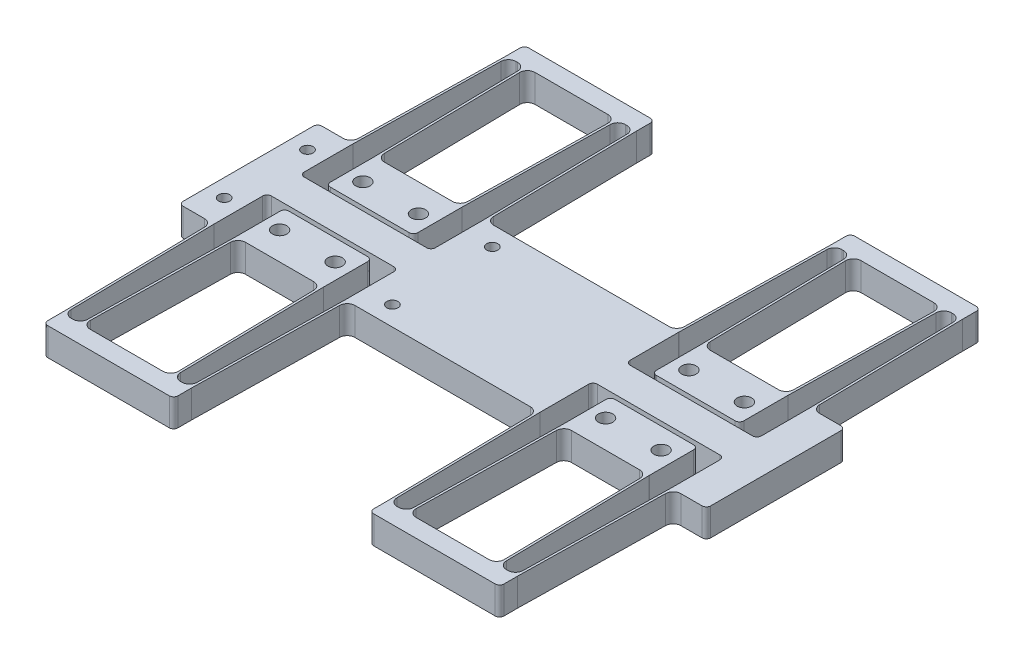
from build123d import *

# Parameters (mm, degrees)
ADJUST_THIS_FLEXTURE_CORNER_W              = 40
ADJUST_THIS_FLEXTURE_CORNER_H              = 22.25
CORNER_EXTRUDE_DEPTH                       = 6.35
FLEXTURE_BEAM_FILLETS_R                    = 3.5
OUTER_FILLETS_R                            = 2
M6_CLEARANCE_HOLE1_D                       = 6.6
FLEXTURE_BEAM_FILLETS_OF_LEFT_RIGHT_MIRR_R = 3.5
OUTER_FILLETS_OF_LEFT_RIGHT_MIRROR_R       = 2
TOP_BOTTOM_MIRROR_START                    = -6.35
TOP_BOTTOM_MIRROR_OUTLINE_R                = 3.3
TOP_BOTTOM_MIRROR_DEPTH                    = 12.7
F_1_4_20_TAPPED_HOLE1_D                    = 5.1054


# Read off the part's stored shape, not the designer's step: Top-Bottom-Mirror
with BuildPart() as part:
    # ADJUST THIS Flexture-Corner → Corner-Extrude (new, symmetric)
    with BuildSketch(Plane(origin=(0, 0, 0), x_dir=(1, 0, 0), z_dir=(0, 1, 0))):
        Polygon((-120.65, 0), (0, 0), (0, 31.75), (-44.549, 31.75), (-44.549, 7.5), (-104.549, 7.5), (-104.549, 31.75), (-120.65, 31.75), align=None)
        Polygon((-44.770702217, 101.75), (-44.770702217, 110), (-104.327297783, 110), (-104.327297783, 101.75), (-103.327145455, 101.75), (-95.770854545, 101.75), (-94.770702217, 101.75), (-54.327297783, 101.75), (-53.327145455, 101.75), (-45.770854545, 101.75), align=None)
        with Locations((-74.549, 20.625)):
            Rectangle(ADJUST_THIS_FLEXTURE_CORNER_W, ADJUST_THIS_FLEXTURE_CORNER_H)
        Polygon((-104.327297783, 101.75), (-105.549152328, 31.75), (-104.549, 31.75), (-103.327145455, 101.75), align=None)
        Polygon((-94.549, 31.75), (-95.770854545, 101.75), (-94.770702217, 101.75), (-93.548847672, 31.75), align=None)
        Polygon((-54.549, 31.75), (-53.327145455, 101.75), (-54.327297783, 101.75), (-55.549152328, 31.75), align=None)
        Polygon((-44.770702217, 101.75), (-43.548847672, 31.75), (-44.549, 31.75), (-45.770854545, 101.75), align=None)
    corner_extrude = extrude(amount=CORNER_EXTRUDE_DEPTH, both=True)

    # Flexture-Beam-Fillets
    flexture_beam_fillets_edges = [part.edges().sort_by_distance(p)[0] for p in [
        (-104.549, 0, -31.75),
        (-44.549, 0, -31.75),
        (-105.549152328, 0, -31.75),
        (-43.548847672, 0, -31.75),
        (-54.327297783, 0, -101.75),
        (-53.327145455, 0, -101.75),
        (-95.770854545, 0, -101.75),
        (-94.770702217, 0, -101.75),
        (-103.327145455, 0, -101.75),
        (-45.770854545, 0, -101.75),
        (-44.770702217, 0, -101.75),
        (-104.327297783, 0, -101.75),
        (-93.548847672, 0, -31.75),
        (-55.549152328, 0, -31.75),
        (-94.549, 0, -31.75),
        (-54.549, 0, -31.75),
    ]]
    fillet(flexture_beam_fillets_edges, radius=FLEXTURE_BEAM_FILLETS_R)

    # Outer-Fillets
    outer_fillets_edges = [part.edges().sort_by_distance(p)[0] for p in [
        (-120.65, 0, -31.75),
        (-104.549, 0, -7.5),
        (-44.549, 0, -7.5),
        (-44.770702217, 0, -110),
        (-104.327297783, 0, -110),
        (-94.549, 0, -9.5),
        (-54.549, 0, -9.5),
    ]]
    fillet(outer_fillets_edges, radius=OUTER_FILLETS_R)

    # M6 Clearance Hole1 (through all)
    with Locations(Plane(origin=(0, 6.35, 0), x_dir=(1, 0, 0), z_dir=(0, 1, 0))):
        with Locations((-87.249, -19.05), (-61.849, -19.05), (-61.849, 19.05), (-87.249, 19.05), (61.849, 19.05), (87.249, 19.05), (61.849, -19.05), (87.249, -19.05)):
            m6_clearance_hole1 = Hole(M6_CLEARANCE_HOLE1_D / 2)

    # Left-Right-Mirror: Corner-Extrude, M6 Clearance Hole1 across plane
    add(corner_extrude.mirror(Plane(origin=(0, 0, 0), x_dir=(0, 0, 1), z_dir=(1, 0, 0))))
    add(m6_clearance_hole1.mirror(Plane(origin=(0, 0, 0), x_dir=(0, 0, 1), z_dir=(1, 0, 0))), mode=Mode.SUBTRACT)

    # Flexture-Beam-Fillets of Left-Right-Mirr
    flexture_beam_fillets_of_left_right_mirr_edges = [part.edges().sort_by_distance(p)[0] for p in [
        (104.549, 0, -31.75),
        (44.549, 0, -31.75),
        (105.549152328, 0, -31.75),
        (43.548847672, 0, -31.75),
        (54.327297783, 0, -101.75),
        (53.327145455, 0, -101.75),
        (95.770854545, 0, -101.75),
        (94.770702217, 0, -101.75),
        (103.327145455, 0, -101.75),
        (45.770854545, 0, -101.75),
        (44.770702217, 0, -101.75),
        (104.327297783, 0, -101.75),
        (93.548847672, 0, -31.75),
        (55.549152328, 0, -31.75),
        (94.549, 0, -31.75),
        (54.549, 0, -31.75),
    ]]
    fillet(flexture_beam_fillets_of_left_right_mirr_edges, radius=FLEXTURE_BEAM_FILLETS_OF_LEFT_RIGHT_MIRR_R)

    # Outer-Fillets of Left-Right-Mirror
    outer_fillets_of_left_right_mirror_edges = [part.edges().sort_by_distance(p)[0] for p in [
        (120.65, 0, -31.75),
        (104.549, 0, -7.5),
        (44.549, 0, -7.5),
        (44.770702217, 0, -110),
        (104.327297783, 0, -110),
        (94.549, 0, -9.5),
        (54.549, 0, -9.5),
    ]]
    fillet(outer_fillets_of_left_right_mirror_edges, radius=OUTER_FILLETS_OF_LEFT_RIGHT_MIRROR_R)

    # Top-Bottom-Mirror outline → Top-Bottom-Mirror (add)
    with BuildSketch(Plane(origin=(0, 0, 0), x_dir=(1, 0, 0), z_dir=(0, 1, 0)).offset(TOP_BOTTOM_MIRROR_START)):
        with BuildLine():
            Line((-120.65, 0), (-120.65, -29.75))
            ThreePointArc((-120.65, -29.75), (-120.064213562, -31.164213562), (-118.65, -31.75))
            Line((-118.65, -31.75), (-108.988592749, -31.75))
            ThreePointArc((-108.988592749, -31.75), (-106.535410324, -32.753623428), (-105.489125816, -35.188916577))
            Line((-105.489125816, -35.188916577), (-104.32783085, -101.719460615))
            ThreePointArc((-104.32783085, -101.719460615), (-104.327431052, -101.750001163), (-104.327297783, -101.780544037))
            Line((-104.327297783, -101.780544037), (-104.327297783, -108))
            ThreePointArc((-104.327297783, -108), (-103.741511345, -109.414213562), (-102.327297783, -110))
            Line((-102.327297783, -110), (-46.770702217, -110))
            ThreePointArc((-46.770702217, -110), (-45.356488655, -109.414213562), (-44.770702217, -108))
            Line((-44.770702217, -108), (-44.770702217, -101.780544037))
            ThreePointArc((-44.770702217, -101.780544037), (-44.770568948, -101.750001163), (-44.77016915, -101.719460615))
            Line((-44.77016915, -101.719460615), (-43.608874184, -35.188916577))
            ThreePointArc((-43.608874184, -35.188916577), (-42.562589676, -32.753623428), (-40.109407251, -31.75))
            Line((-40.109407251, -31.75), (40.109407251, -31.75))
            ThreePointArc((40.109407251, -31.75), (42.562589676, -32.753623428), (43.608874184, -35.188916577))
            Line((43.608874184, -35.188916577), (44.77016915, -101.719460615))
            ThreePointArc((44.77016915, -101.719460615), (44.770568948, -101.750001163), (44.770702217, -101.780544037))
            Line((44.770702217, -101.780544037), (44.770702217, -108))
            ThreePointArc((44.770702217, -108), (45.356488655, -109.414213562), (46.770702217, -110))
            Line((46.770702217, -110), (102.327297783, -110))
            ThreePointArc((102.327297783, -110), (103.741511345, -109.414213562), (104.327297783, -108))
            Line((104.327297783, -108), (104.327297783, -101.780544037))
            ThreePointArc((104.327297783, -101.780544037), (104.327431052, -101.750001163), (104.32783085, -101.719460615))
            Line((104.32783085, -101.719460615), (105.489125816, -35.188916577))
            ThreePointArc((105.489125816, -35.188916577), (106.535410324, -32.753623428), (108.988592749, -31.75))
            Line((108.988592749, -31.75), (118.65, -31.75))
            ThreePointArc((118.65, -31.75), (120.064213562, -31.164213562), (120.65, -29.75))
            Line((120.65, -29.75), (120.65, 0))
            Line((120.65, 0), (-120.65, 0))
        make_face()
        with BuildLine():
            ThreePointArc((-93.608874184, -35.188916577), (-92.562589676, -32.753623428), (-90.109407251, -31.75))
            Line((-90.109407251, -31.75), (-58.988592749, -31.75))
            ThreePointArc((-58.988592749, -31.75), (-56.535410324, -32.753623428), (-55.489125816, -35.188916577))
            Line((-55.489125816, -35.188916577), (-54.389456725, -98.188916577))
            ThreePointArc((-54.389456725, -98.188916577), (-55.392547086, -100.703182425), (-57.888923658, -101.75))
            Line((-57.888923658, -101.75), (-91.209076342, -101.75))
            ThreePointArc((-91.209076342, -101.75), (-93.705452914, -100.703182425), (-94.708543275, -98.188916577))
            Line((-94.708543275, -98.188916577), (-93.608874184, -35.188916577))
        make_face(mode=Mode.SUBTRACT)
        with BuildLine():
            Line((58.988592749, -31.75), (90.109407251, -31.75))
            ThreePointArc((90.109407251, -31.75), (92.562589676, -32.753623428), (93.608874184, -35.188916577))
            Line((93.608874184, -35.188916577), (94.708543275, -98.188916577))
            ThreePointArc((94.708543275, -98.188916577), (93.705452914, -100.703182425), (91.209076342, -101.75))
            Line((91.209076342, -101.75), (57.888923658, -101.75))
            ThreePointArc((57.888923658, -101.75), (55.392547086, -100.703182425), (54.389456725, -98.188916577))
            Line((54.389456725, -98.188916577), (55.489125816, -35.188916577))
            ThreePointArc((55.489125816, -35.188916577), (56.535410324, -32.753623428), (58.988592749, -31.75))
        make_face(mode=Mode.SUBTRACT)
        with BuildLine():
            ThreePointArc((-46.549, -7.5), (-45.134786438, -8.085786438), (-44.549, -9.5))
            Line((-44.549, -9.5), (-44.549, -31.719455963))
            ThreePointArc((-44.549, -31.719455963), (-44.549133269, -31.749998837), (-44.549533067, -31.780539385))
            Line((-44.549533067, -31.780539385), (-45.710828033, -98.311083423))
            ThreePointArc((-45.710828033, -98.311083423), (-46.757112541, -100.746376572), (-49.210294966, -101.75))
            Line((-49.210294966, -101.75), (-49.887705034, -101.75))
            ThreePointArc((-49.887705034, -101.75), (-52.340887459, -100.746376572), (-53.387171967, -98.311083423))
            Line((-53.387171967, -98.311083423), (-54.548466933, -31.780539385))
            ThreePointArc((-54.548466933, -31.780539385), (-54.548866731, -31.749998837), (-54.549, -31.719455963))
            Line((-54.549, -31.719455963), (-54.549, -11.5))
            ThreePointArc((-54.549, -11.5), (-55.134786438, -10.085786438), (-56.549, -9.5))
            Line((-56.549, -9.5), (-92.549, -9.5))
            ThreePointArc((-92.549, -9.5), (-93.963213562, -10.085786438), (-94.549, -11.5))
            Line((-94.549, -11.5), (-94.549, -31.719455963))
            ThreePointArc((-94.549, -31.719455963), (-94.549133269, -31.749998837), (-94.549533067, -31.780539385))
            Line((-94.549533067, -31.780539385), (-95.710828033, -98.311083423))
            ThreePointArc((-95.710828033, -98.311083423), (-96.757112541, -100.746376572), (-99.210294966, -101.75))
            Line((-99.210294966, -101.75), (-99.887705034, -101.75))
            ThreePointArc((-99.887705034, -101.75), (-102.340887459, -100.746376572), (-103.387171967, -98.311083423))
            Line((-103.387171967, -98.311083423), (-104.548466933, -31.780539385))
            ThreePointArc((-104.548466933, -31.780539385), (-104.548866731, -31.749998837), (-104.549, -31.719455963))
            Line((-104.549, -31.719455963), (-104.549, -9.5))
            ThreePointArc((-104.549, -9.5), (-103.963213562, -8.085786438), (-102.549, -7.5))
            Line((-102.549, -7.5), (-46.549, -7.5))
        make_face(mode=Mode.SUBTRACT)
        with Locations((-87.249, -19.05)):
            Circle(TOP_BOTTOM_MIRROR_OUTLINE_R, mode=Mode.SUBTRACT)
        with Locations((-61.849, -19.05)):
            Circle(TOP_BOTTOM_MIRROR_OUTLINE_R, mode=Mode.SUBTRACT)
        with BuildLine():
            Line((104.549, -9.5), (104.549, -31.719455963))
            ThreePointArc((104.549, -31.719455963), (104.548866731, -31.749998837), (104.548466933, -31.780539385))
            Line((104.548466933, -31.780539385), (103.387171967, -98.311083423))
            ThreePointArc((103.387171967, -98.311083423), (102.340887459, -100.746376572), (99.887705034, -101.75))
            Line((99.887705034, -101.75), (99.210294966, -101.75))
            ThreePointArc((99.210294966, -101.75), (96.757112541, -100.746376572), (95.710828033, -98.311083423))
            Line((95.710828033, -98.311083423), (94.549533067, -31.780539385))
            ThreePointArc((94.549533067, -31.780539385), (94.549133269, -31.749998837), (94.549, -31.719455963))
            Line((94.549, -31.719455963), (94.549, -11.5))
            ThreePointArc((94.549, -11.5), (93.963213562, -10.085786438), (92.549, -9.5))
            Line((92.549, -9.5), (56.549, -9.5))
            ThreePointArc((56.549, -9.5), (55.134786438, -10.085786438), (54.549, -11.5))
            Line((54.549, -11.5), (54.549, -31.719455963))
            ThreePointArc((54.549, -31.719455963), (54.548866731, -31.749998837), (54.548466933, -31.780539385))
            Line((54.548466933, -31.780539385), (53.387171967, -98.311083423))
            ThreePointArc((53.387171967, -98.311083423), (52.340887459, -100.746376572), (49.887705034, -101.75))
            Line((49.887705034, -101.75), (49.210294966, -101.75))
            ThreePointArc((49.210294966, -101.75), (46.757112541, -100.746376572), (45.710828033, -98.311083423))
            Line((45.710828033, -98.311083423), (44.549533067, -31.780539385))
            ThreePointArc((44.549533067, -31.780539385), (44.549133269, -31.749998837), (44.549, -31.719455963))
            Line((44.549, -31.719455963), (44.549, -9.5))
            ThreePointArc((44.549, -9.5), (45.134786438, -8.085786438), (46.549, -7.5))
            Line((46.549, -7.5), (102.549, -7.5))
            ThreePointArc((102.549, -7.5), (103.963213562, -8.085786438), (104.549, -9.5))
        make_face(mode=Mode.SUBTRACT)
        with Locations((61.849, -19.05)):
            Circle(TOP_BOTTOM_MIRROR_OUTLINE_R, mode=Mode.SUBTRACT)
        with Locations((87.249, -19.05)):
            Circle(TOP_BOTTOM_MIRROR_OUTLINE_R, mode=Mode.SUBTRACT)
    extrude(amount=TOP_BOTTOM_MIRROR_DEPTH)

    # 1/4-20 Tapped Hole1 (through all)
    with Locations(Plane(origin=(0, 6.35, 0), x_dir=(1, 0, 0), z_dir=(0, 1, 0))):
        with Locations((-112.5995, 19.05), (-31.849, 22.86), (-31.849, -22.86), (-112.5995, -19.05)):
            Hole(F_1_4_20_TAPPED_HOLE1_D / 2)


solid = part.part
